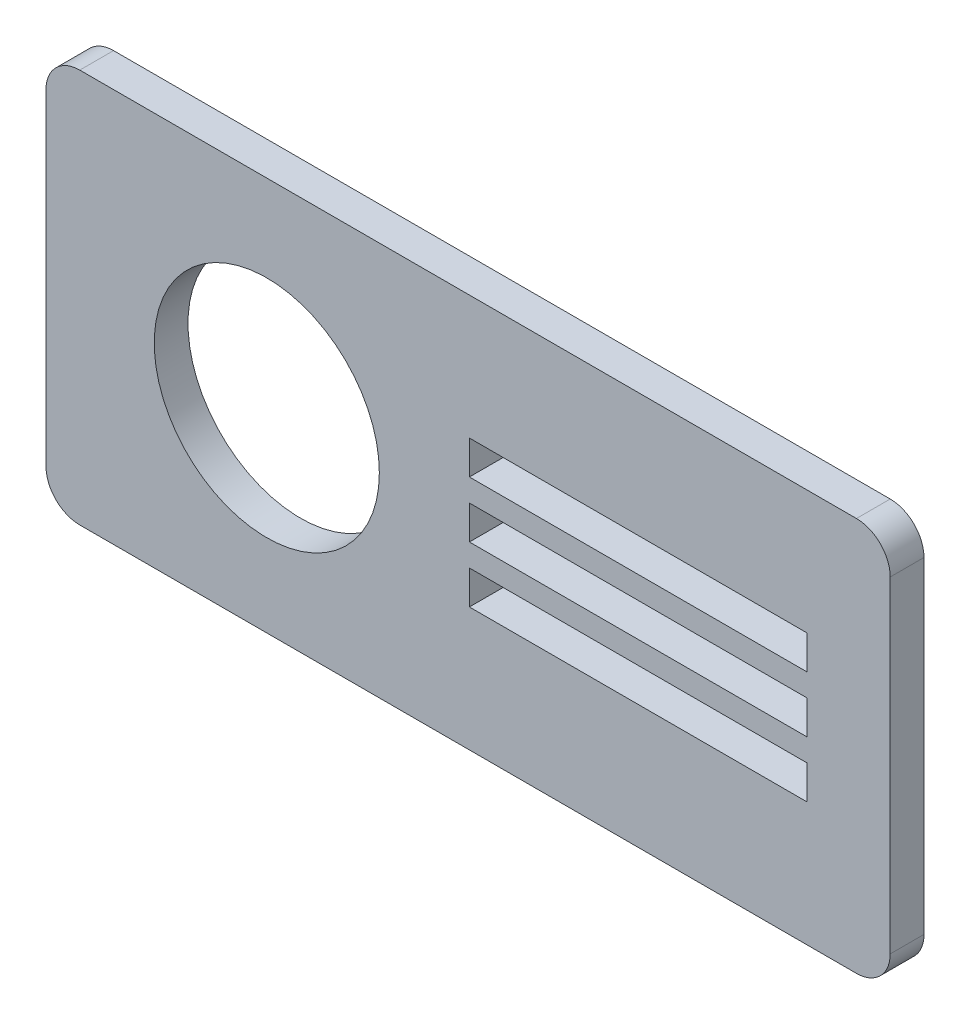
from build123d import *

# Parameters (mm, degrees)
SKETCH1_R           = 10
SKETCH1_W           = 30
SKETCH1_H           = 3
BOSS_EXTRUDE1_DEPTH = 3


with BuildPart() as part:
    # Sketch1 → Boss-Extrude1 (new body)
    with BuildSketch(Plane.XY):
        with BuildLine():
            Line((-78.5, 101.203720637), (-147.5, 101.203720637))
            ThreePointArc((-147.5, 101.203720637), (-149.621320344, 100.325040981), (-150.5, 98.203720637))
            Line((-150.5, 98.203720637), (-150.5, 69.203720637))
            ThreePointArc((-150.5, 69.203720637), (-149.621320344, 67.082400294), (-147.5, 66.203720637))
            Line((-147.5, 66.203720637), (-78.5, 66.203720637))
            ThreePointArc((-78.5, 66.203720637), (-76.378679656, 67.082400294), (-75.5, 69.203720637))
            Line((-75.5, 69.203720637), (-75.5, 98.203720637))
            ThreePointArc((-75.5, 98.203720637), (-76.378679656, 100.325040981), (-78.5, 101.203720637))
        make_face()
        with Locations((-130.886316496, 83.527802162)):
            Circle(SKETCH1_R, mode=Mode.SUBTRACT)
        with Locations((-97.886316496, 83.703720637)):
            Rectangle(SKETCH1_W, SKETCH1_H, mode=Mode.SUBTRACT)
        with Locations((-97.886316496, 88.703720637)):
            Rectangle(SKETCH1_W, SKETCH1_H, mode=Mode.SUBTRACT)
        with Locations((-97.886316496, 78.703720637)):
            Rectangle(SKETCH1_W, SKETCH1_H, mode=Mode.SUBTRACT)
    extrude(amount=-BOSS_EXTRUDE1_DEPTH)


solid = part.part
